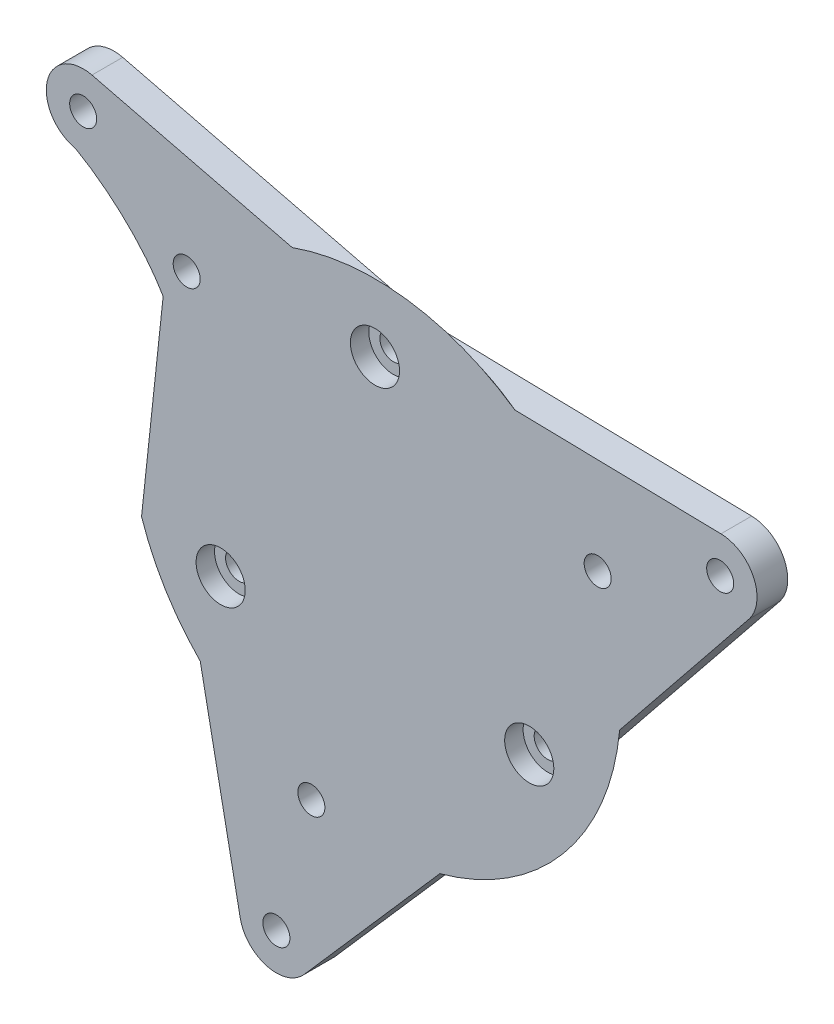
from build123d import *

# Parameters (mm, degrees)
SKETCH_1_R               = 40
SKETCH_2_R               = 33.35
SKETCH_3_R               = 2.2
CUT_EXTRUDE_1_DEPTH      = 57.789083608
SKETCH_4_R               = 4
CUT_EXTRUDE_2_DEPTH      = 3
OTHER_START              = -5
OTHER_1_OUTLINE_R        = 4
OTHER_1_OUTLINE_R_2      = 2.9
OTHER_1_OUTLINE_R_3      = 11
OTHER_1_OUTLINE_R_4      = 9
OTHER_1_DEPTH            = 1.5
CUT_EXTRUDE_START        = 27
SKETCH_5_R               = 11.2
SKETCH_5_R_2             = 4.2
CUT_EXTRUDE_3_DEPTH      = 1.5
SKETCH_7_R               = 2.2
EXTRUDE_1_DEPTH          = 5
HOLE_WIZARD_4_4_4_4_1_D  = 4.4
CUT_EXTRUDE_4_DEPTH      = 91.740732016
CUT_EXTRUDE_4_DEPTH_BACK = 91.740732016


# Read off the part's stored shape, not the designer's step: 型腔1
with BuildPart() as part:
    # 草图1 → 放样2 section 0
    with BuildSketch(Plane.XY):
        Circle(SKETCH_1_R)
    # 草图2 → 放样2 section 1
    with BuildSketch(Plane.XY.offset(-5)):
        Circle(SKETCH_2_R)
    loft()

    # 草图3 → 切除-拉伸1 (cut, through all)
    with BuildSketch(Plane(origin=(0, 0, -5), x_dir=(-1, 0, 0), z_dir=(0, 0, -1))):
        with Locations((-25.11473671, -14.5)):
            Circle(SKETCH_3_R)
        with Locations((25.11473671, -14.5)):
            Circle(SKETCH_3_R)
        with Locations((0, 29)):
            Circle(SKETCH_3_R)
    extrude(amount=-CUT_EXTRUDE_1_DEPTH, mode=Mode.SUBTRACT)

    # 草图4 → 切除-拉伸2 (cut)
    with BuildSketch(Plane.XY):
        with Locations((0, 29)):
            Circle(SKETCH_4_R)
        with Locations((25.11473671, -14.5)):
            Circle(SKETCH_4_R)
        with Locations((-25.11473671, -14.5)):
            Circle(SKETCH_4_R)
    extrude(amount=-CUT_EXTRUDE_2_DEPTH, mode=Mode.SUBTRACT)

    # 型腔1 outline → 型腔1 (cut)
    # profile 1 of 2: a face of its own
    with BuildSketch(Plane.XY.offset(OTHER_START)):
        with Locations((-16.670989023, -9.625)):
            Circle(OTHER_1_OUTLINE_R)
        with Locations((-16.670989023, -9.625)):
            Circle(OTHER_1_OUTLINE_R_2, mode=Mode.SUBTRACT)
    # profile 2 of 2: a face of its own
    with BuildSketch(Plane.XY.offset(OTHER_START)):
        Circle(OTHER_1_OUTLINE_R_3)
        Circle(OTHER_1_OUTLINE_R_4, mode=Mode.SUBTRACT)
    extrude(amount=OTHER_1_DEPTH, mode=Mode.SUBTRACT)

    # 草图5 → 切除-拉伸3 (cut)
    with BuildSketch(Plane(origin=(52.090644265, -18.098750786, 23.5), x_dir=(0.9659258262890773, -0.2588190451024873, 0), z_dir=(0, 0, -1)).offset(CUT_EXTRUDE_START)):
        with Locations(Location((-55, -4, 0), (0, 0, 345))):
            Circle(SKETCH_5_R)
        with Locations(Location((-68.611805538, 9.611805538, 0), (0, 0, 345))):
            Circle(SKETCH_5_R_2)
    extrude(amount=CUT_EXTRUDE_3_DEPTH, mode=Mode.SUBTRACT)

    # 草图7 → 凸台-拉伸1 (add)
    # profile 1 of 5: a face of its own
    with BuildSketch(Plane.XY):
        with BuildLine():
            Line((56.314218304, 32.201068565), (22.765462134, 32.889720793))
            ThreePointArc((22.765462134, 32.889720793), (35.43034353, 18.565849222), (40, 0))
            ThreePointArc((40, 0), (39.957063165, -1.852863527), (39.828344838, -3.701749249))
            Line((39.828344838, -3.701749249), (60.865531412, 22.440746108))
            ThreePointArc((60.865531412, 22.440746108), (61.628929518, 28.738041798), (56.314218304, 32.201068565))
        make_face()
        with Locations((56.191082796, 26.202332228)):
            Circle(SKETCH_7_R, mode=Mode.SUBTRACT)
    # profile 2 of 5: a face of its own
    with BuildSketch(Plane.XY):
        with BuildLine():
            Line((-13.477261693, 37.661165904), (-46.06110803, 45.679035969))
            ThreePointArc((-46.06110803, 45.679035969), (-53.34269802, 41.195056807), (-48.745228802, 33.984585346))
            add(Edge.make_bspline(
                [(-48.745228802, 33.984585346), (-43.952768946, 31.311585993), (-37.935277565, 26.17758836), (-34.474104128, 20.286353653)],
                knots=[0, 0, 0, 0, 0.622020345, 0.622020345, 0.622020345, 0.622020345], degree=3))
            ThreePointArc((-34.474104128, 20.286353653), (-25.50106657, 30.81713166), (-13.477261693, 37.661165904))
        make_face()
        with Locations((-47.494755473, 39.852831801)):
            Circle(SKETCH_7_R, mode=Mode.SUBTRACT)
    # profile 3 of 5: a face of its own
    with BuildSketch(Plane.XY):
        with BuildLine():
            Line((4.379699915, 33.26712364), (-13.477261693, 37.661165904))
            ThreePointArc((-13.477261693, 37.661165904), (-25.50106657, 30.81713166), (-34.474104128, 20.286353653))
            add(Edge.make_bspline(
                [(-34.474104128, 20.286353653), (-33.715659981, 18.995412138), (-31.952819591, 15.314686764), (-31.439882273, 11.492206468), (-32.192854649, 8.708766247)],
                knots=[0.622020345, 0.622020345, 0.622020345, 0.622020345, 0.758323162, 1, 1, 1, 1], degree=3))
            ThreePointArc((-32.192854649, 8.708766247), (4.392652812, 33.059447988), (33.35, 0))
            ThreePointArc((33.35, 0), (31.454149072, -11.084178191), (25.982143558, -20.908149515))
            Line((25.982143558, -20.908149515), (39.828344838, -3.701749249))
            ThreePointArc((39.828344838, -3.701749249), (39.957063165, -1.852863527), (40, 0))
            ThreePointArc((40, 0), (35.43034353, 18.565849222), (22.765462134, 32.889720793))
            Line((22.765462134, 32.889720793), (4.379699915, 33.26712364))
        make_face()
    # profile 4 of 5: a face of its own
    with BuildSketch(Plane.XY):
        with BuildLine():
            ThreePointArc((10.561630861, -38.580460774), (-10.352761804, -38.637033052), (-28.436871018, -28.13084369))
            Line((-28.436871018, -28.13084369), (-21.933000593, -61.050335666))
            ThreePointArc((-21.933000593, -61.050335666), (-17.599695067, -65.682956188), (-11.530632138, -63.837641893))
            Line((-11.530632138, -63.837641893), (10.561630861, -38.580460774))
        make_face()
        with Locations((-16.046780796, -59.88740123)):
            Circle(SKETCH_7_R, mode=Mode.SUBTRACT)
    # profile 5 of 5: a face of its own
    with BuildSketch(Plane.XY):
        with BuildLine():
            Line((-32.717571704, -6.463977243), (-28.436871018, -28.13084369))
            ThreePointArc((-28.436871018, -28.13084369), (-10.352761804, -38.637033052), (10.561630861, -38.580460774))
            Line((10.561630861, -38.580460774), (25.102259624, -21.956754354))
            ThreePointArc((25.102259624, -21.956754354), (-8.631615154, -32.213626307), (-32.717571704, -6.463977243))
        make_face()
    extrude(amount=-EXTRUDE_1_DEPTH)

    # Ø4.4 (4.4) 直径孔1 (through all)
    with Locations(Plane(origin=(0, 0, -5), x_dir=(-1, 0, 0), z_dir=(0, 0, -1))):
        with Locations((10.352761804, -38.637033052), (-36.252311481, 16.90473047), (30.641777725, 25.711504387)):
            Hole(HOLE_WIZARD_4_4_4_4_1_D / 2)

    # 草图10 → 切除-拉伸4 (cut, two sides: drawn at the far end of the back side and taken through both)
    with BuildSketch(Plane(origin=(0, 0, -5), x_dir=(-1, 0, 0), z_dir=(0, 0, -1)).offset(-CUT_EXTRUDE_4_DEPTH_BACK)):
        Polygon((34.47410458, 20.28635588), (38.372841801, -16.056659606), (62.683016438, 23.101645648), align=None)
    extrude(amount=CUT_EXTRUDE_4_DEPTH + CUT_EXTRUDE_4_DEPTH_BACK, mode=Mode.SUBTRACT)


solid = part.part
